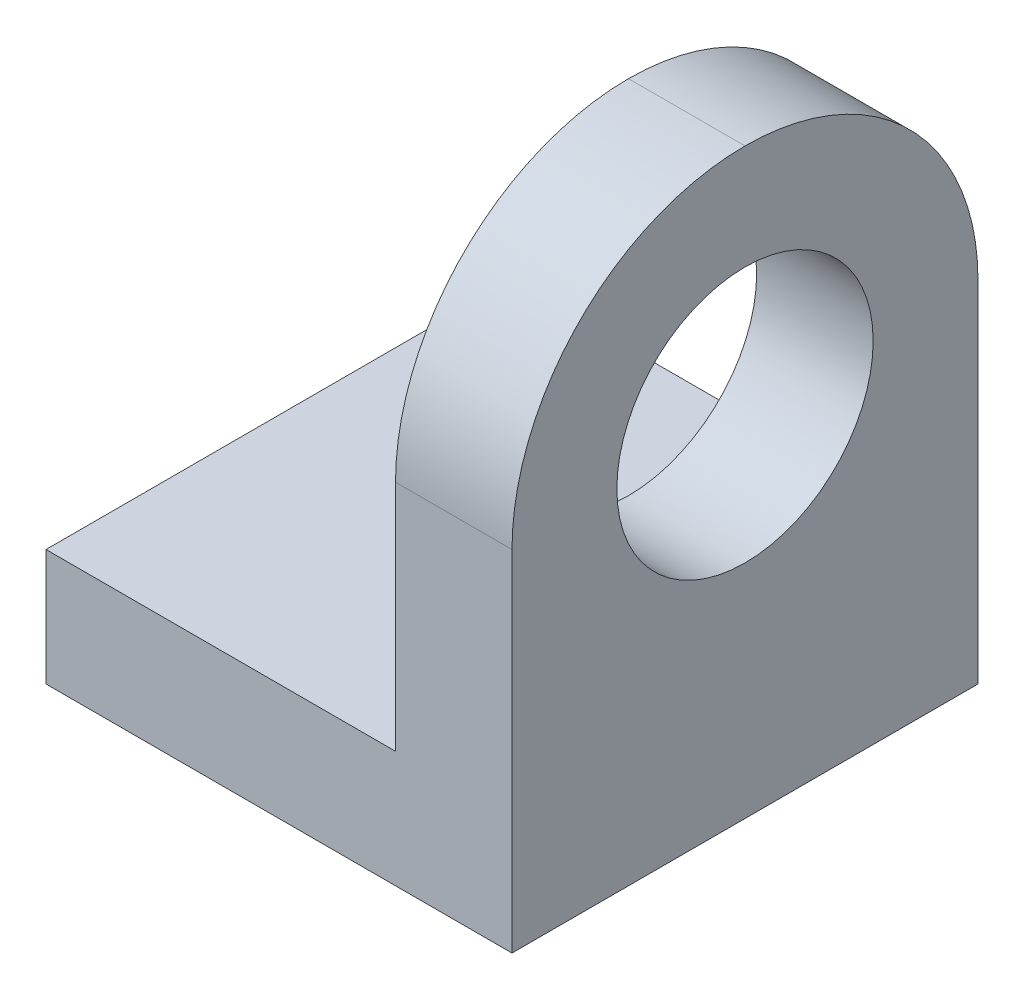
from build123d import *

# Parameters (mm, degrees)
SKETCH1_W           = 20
SKETCH1_H           = 20
BOSS_EXTRUDE1_DEPTH = 5
SKETCH2_W           = 5
SKETCH2_H           = 20
BOSS_EXTRUDE2_DEPTH = 20
SKETCH3_R           = 5.5
CUT_EXTRUDE1_DEPTH  = 34.541019662
FILLET1_R           = 10


with BuildPart() as part:
    # Sketch1 → Boss-Extrude1 (new body)
    with BuildSketch(Plane(origin=(0, 0, 0), x_dir=(1, 0, 0), z_dir=(0, 1, 0))):
        Rectangle(SKETCH1_W, SKETCH1_H)
    extrude(amount=BOSS_EXTRUDE1_DEPTH)

    # Sketch2 → Boss-Extrude2 (add)
    with BuildSketch(Plane(origin=(0, 5, 0), x_dir=(1, 0, 0), z_dir=(0, 1, 0))):
        with Locations((7.5, 0)):
            Rectangle(SKETCH2_W, SKETCH2_H)
    extrude(amount=BOSS_EXTRUDE2_DEPTH)

    # Sketch3 → Cut-Extrude1 (cut, through all)
    with BuildSketch(Plane(origin=(10, 0, 0), x_dir=(0, 0, -1), z_dir=(1, 0, 0))):
        with Locations((0, 15)):
            Circle(SKETCH3_R)
    extrude(amount=-CUT_EXTRUDE1_DEPTH, mode=Mode.SUBTRACT)

    # Fillet1
    fillet1_edges = [part.edges().sort_by_distance(p)[0] for p in [
        (7.5, 25, -10),
        (7.5, 25, 10),
    ]]
    fillet(fillet1_edges, radius=FILLET1_R - 0.0001)  # a hair under: the kernel refuses the full size


solid = part.part
